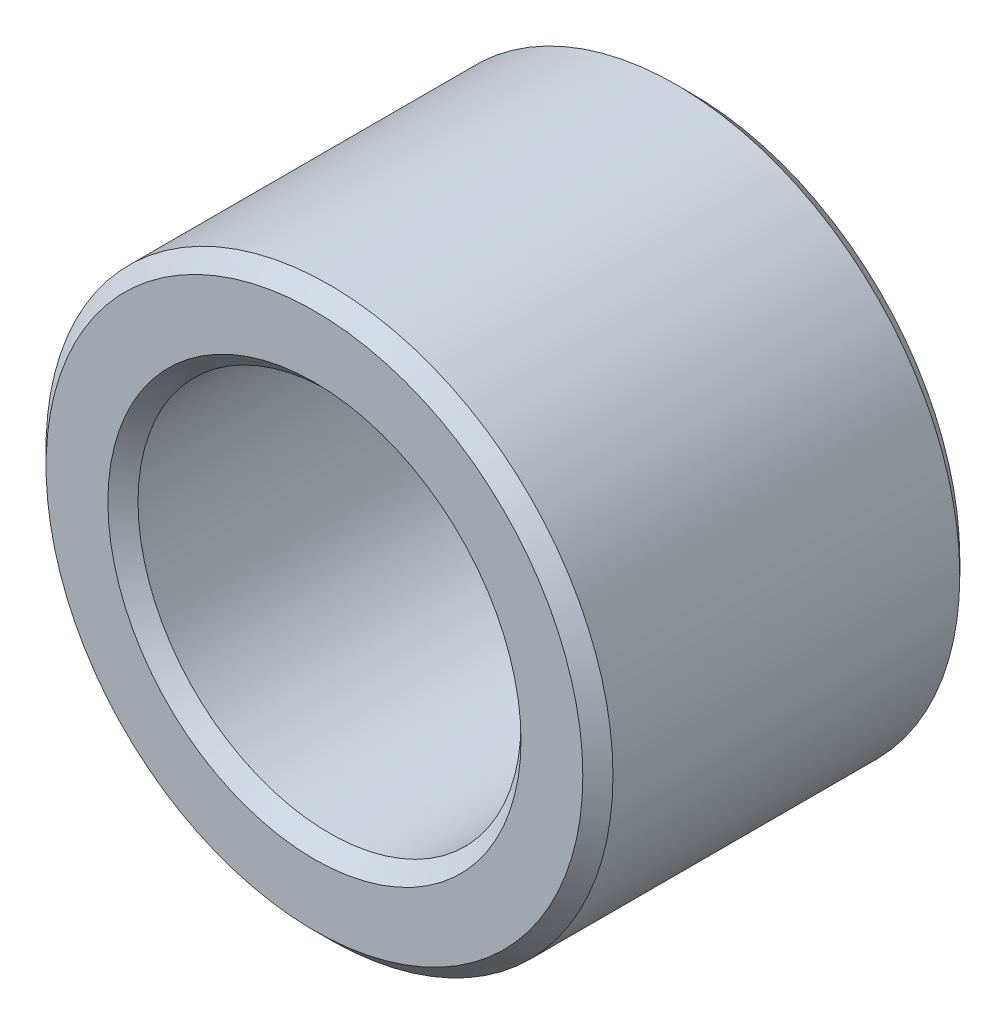
from build123d import *

# Parameters (mm, degrees)
SKETCH1_R      = 4.7752
SKETCH1_R_2    = 3.2258
EXTRUDE1_DEPTH = 3.175
CHAMFER1_SIZE  = 0.254


with BuildPart() as part:
    # Sketch1 → Extrude1 (new, symmetric)
    with BuildSketch(Plane.XY):
        Circle(SKETCH1_R)
        Circle(SKETCH1_R_2, mode=Mode.SUBTRACT)
    extrude(amount=EXTRUDE1_DEPTH, both=True)

    # Chamfer1
    chamfer1_edges = [part.edges().sort_by_distance(p)[0] for p in [
        (-3.2258, 0, -3.175),
        (-4.7752, 0, -3.175),
        (-3.2258, 0, 3.175),
        (-4.7752, 0, 3.175),
    ]]
    chamfer(chamfer1_edges, length=CHAMFER1_SIZE)


solid = part.part
